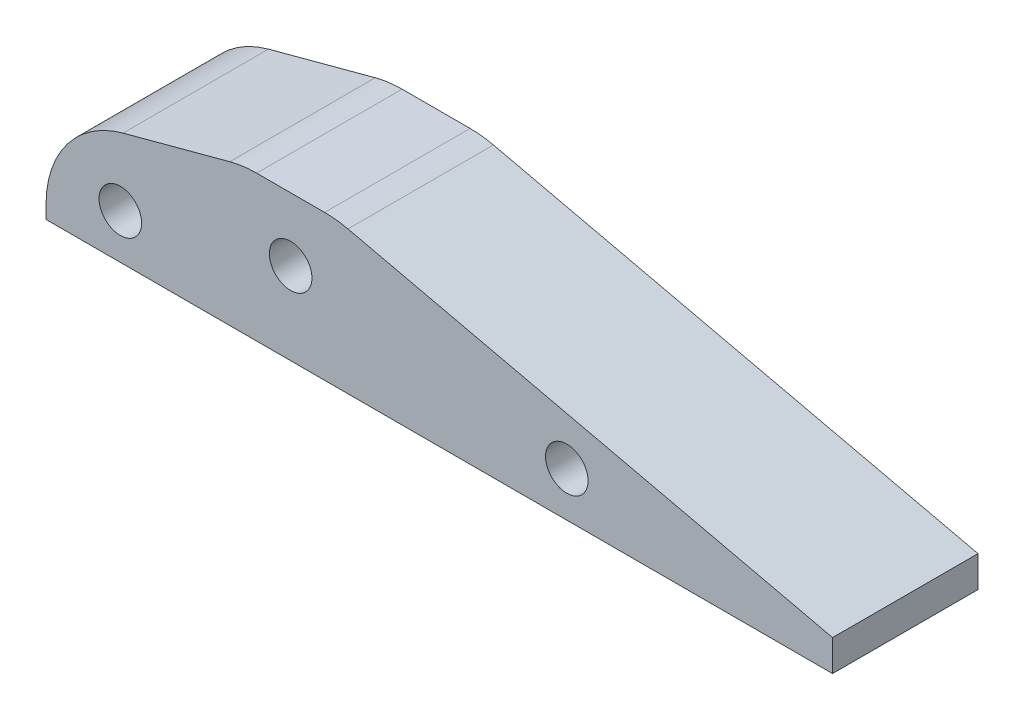
from build123d import *

# Parameters (mm, degrees)
BOSS_EXTRUDE1_DEPTH = 14
FILLET1_R           = 10
FILLET2_R           = 10
CUT_EXTRUDE1_DEPTH  = 5
SKETCH3_R           = 2.05
CUT_EXTRUDE2_DEPTH  = 78.515972824


with BuildPart() as part:
    # Sketch1 → Boss-Extrude1 (new body)
    with BuildSketch(Plane.XY):
        Polygon((0, 0), (0, 8.92), (18.958818102, 14), (27.958818102, 14), (75.708163648, 3), (75.708163648, 0), align=None)
    extrude(amount=BOSS_EXTRUDE1_DEPTH)

    # Fillet1
    fillet1_edges = [part.edges().sort_by_distance(p)[0] for p in [
        (0, 8.92, 7),
    ]]
    fillet(fillet1_edges, radius=FILLET1_R)

    # Fillet2
    fillet2_edges = [part.edges().sort_by_distance(p)[0] for p in [
        (27.958818102, 14, 7),
        (18.958818102, 14, 7),
    ]]
    fillet(fillet2_edges, radius=FILLET2_R)

    # Sketch2 → Cut-Extrude1 (cut)
    with BuildSketch(Plane(origin=(0, 0, 0), x_dir=(-1, 0, 0), z_dir=(0, 0, -1))):
        Polygon((-52.17923967, 7.843591352), (-54.228833126, 4.293591352), (-52.17923967, 0.743591352), (-48.080052759, 0.743591352), (-46.030459303, 4.293591352), (-48.080052759, 7.843591352), align=None)
        Polygon((-25.598194748, 11.456888356), (-27.647788204, 7.906888356), (-25.598194748, 4.356888356), (-21.499007837, 4.356888356), (-19.449414382, 7.906888356), (-21.499007837, 11.456888356), align=None)
        Polygon((-9.204597923, 7.843591352), (-11.254191379, 4.293591352), (-9.204597923, 0.743591352), (-5.105411012, 0.743591352), (-3.055817556, 4.293591352), (-5.105411012, 7.843591352), align=None)
    extrude(amount=-CUT_EXTRUDE1_DEPTH, mode=Mode.SUBTRACT)

    # Sketch3 → Cut-Extrude2 (cut, through all)
    with BuildSketch(Plane(origin=(0, 0, 5), x_dir=(-1, 0, 0), z_dir=(0, 0, -1))):
        with Locations((-50.129646215, 4.293591352)):
            Circle(SKETCH3_R)
        with Locations((-23.548601293, 7.906888356)):
            Circle(SKETCH3_R)
        with Locations((-7.155004468, 4.293591352)):
            Circle(SKETCH3_R)
    extrude(amount=-CUT_EXTRUDE2_DEPTH, mode=Mode.SUBTRACT)


solid = part.part
